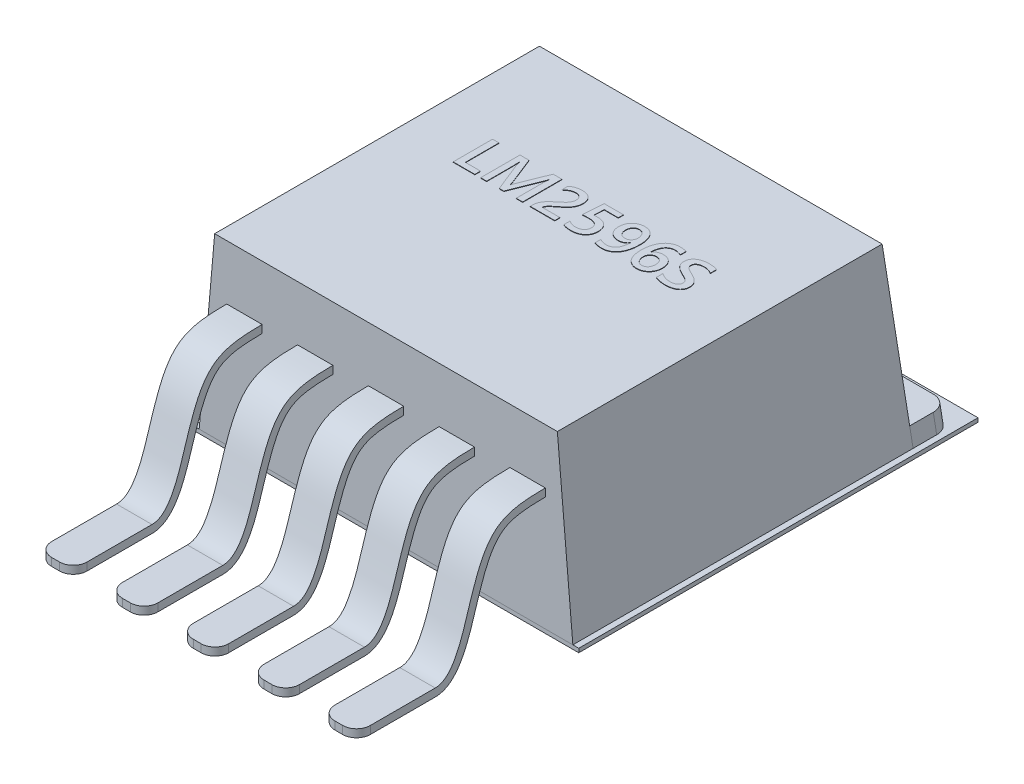
from build123d import *

# Parameters (mm, degrees)
SKETCH1_W           = 9.5
SKETCH1_H           = 8.65
BOSS_EXTRUDE1_DEPTH = 4.5
CHAMFER1_SIZE       = 4.5
CHAMFER1_SIZE_2     = 0.393698986
BOSS_EXTRUDE2_DEPTH = 0.5
SKETCH5_W           = 9.8
SKETCH5_H           = 10.15
BOSS_EXTRUDE3_DEPTH = 0.1
EXTRUDE_THIN1_START = -0.45
EXTRUDE_THIN1_DEPTH = 0.9
FILLET1_R           = 0.35
LPATTERN1_COUNT     = 3
LPATTERN1_PITCH     = 1.8
LPATTERN2_COUNT     = 3
LPATTERN2_PITCH     = 1.8
BOSS_EXTRUDE4_DEPTH = 0.01


# Read off the part's stored shape, not the designer's step: Extrude-Thin1
with BuildPart() as part:
    # Sketch1 → Boss-Extrude1 (new body)
    with BuildSketch(Plane(origin=(0, 0, 0), x_dir=(1, 0, 0), z_dir=(0, 1, 0))):
        Rectangle(SKETCH1_W, SKETCH1_H)
    extrude(amount=BOSS_EXTRUDE1_DEPTH)

    # Chamfer1
    # the kernel refuses this chamfer: 4.5, 0.393698986 mm, written as the material it takes off along each edge
    with BuildSketch(Plane(origin=(-4.75, 4.5, -16.023353359), x_dir=(-0.003352615794033216, -0.9999943799678764, 0), z_dir=(0, 0, 1)), Plane(origin=(4.75, 4.5, 16.023353359), x_dir=(0.003352615794033216, -0.9999943799678764, 0), z_dir=(0, 0, -1))) as chamfer1_piece_1:
        Polygon((CHAMFER1_SIZE * 0.999994379968, CHAMFER1_SIZE * 0.00335261579403), (-CHAMFER1_SIZE_2 * 0.0033526157929, CHAMFER1_SIZE_2 * 0.999994379629), (0, 0), align=None)
    extrude(amount=32.046706719, mode=Mode.SUBTRACT)
    with BuildSketch(Plane(origin=(16.448353359, 4.5, -4.325), x_dir=(0, -0.9999943799678764, -0.003352615794033216), z_dir=(-1, 0, 0))) as chamfer1_piece_2:
        Polygon((CHAMFER1_SIZE * 0.999994379968, CHAMFER1_SIZE * 0.00335261579403), (-CHAMFER1_SIZE_2 * 0.0033526157929, CHAMFER1_SIZE_2 * 0.999994379629), (0, 0), align=None)
    extrude(amount=32.896706719, mode=Mode.SUBTRACT)


with BuildPart() as body_2:
    # Sketch2 → Boss-Extrude2 (new, along a direction that is not the sketch's normal)
    with BuildSketch(Plane.XZ):
        with BuildLine():
            Line((0, -4.025), (4.75, -4.025))
            Line((4.75, -4.025), (4.75, -4.925))
            ThreePointArc((4.75, -4.925), (4.632842712, -5.207842712), (4.35, -5.325))
            Line((4.35, -5.325), (0, -5.325))
            Line((0, -5.325), (0, -4.025))
        make_face()
    extrude(amount=-BOSS_EXTRUDE2_DEPTH, dir=(0.08682659386424435, -0.9924325091389676, -0.08682659386424435))


with BuildPart() as body_3:
    # Mirror2: mirrored copy
    add(body_2.part.mirror(Plane(origin=(0, 0, 0), x_dir=(0, 0, 1), z_dir=(1, 0, 0))))


with BuildPart() as body_2_1:
    add(body_2.part)

    # Combine1: union body 3, part
    add(body_3.part)
    add(part.part)

    # Sketch7 → Boss-Extrude4 (add)
    # profile 1 of 7: a face of its own
    with BuildSketch(Plane(origin=(0, 4.5, 0), x_dir=(1, 0, 0), z_dir=(0, 1, 0))):
        Polygon((-2.344036286, 0.277881161), (-2.895023128, 0.277881161), (-2.895023128, 1.277881161), (-2.729727076, 1.277881161), (-2.729727076, 0.422618003), (-2.344036286, 0.422618003), align=None)
    # profile 2 of 7: a face of its own
    with BuildSketch(Plane(origin=(0, 4.5, 0), x_dir=(1, 0, 0), z_dir=(0, 1, 0))):
        with BuildLine():
            Line((-1.128986944, 0.277881161), (-1.292843852, 0.277881161))
            Line((-1.292843852, 0.277881161), (-1.292843852, 0.925085109))
            add(Edge.make_bspline(
                [(-1.292843852, 0.925085109), (-1.292712282, 0.939067113), (-1.292434853, 0.968549586), (-1.290442565, 1.014954023), (-1.287373248, 1.065813256), (-1.284483021, 1.101145404), (-1.282975431, 1.11957524)],
                knots=[0, 0, 0, 0, 0.861329844, 1.816201289, 2.860894294, 4, 4, 4, 4], degree=3))
            Line((-1.282975431, 1.11957524), (-1.28585372, 1.11957524))
            add(Edge.make_bspline(
                [(-1.28585372, 1.11957524), (-1.288257915, 1.109416125), (-1.292722069, 1.090552492), (-1.299782224, 1.064751168), (-1.305867666, 1.04334486), (-1.310654386, 1.030939245), (-1.312786286, 1.025414056)],
                knots=[0, 0, 0, 0, 1.277912959, 2.372852416, 3.275304104, 4, 4, 4, 4], degree=3))
            Line((-1.312786286, 1.025414056), (-1.609866878, 0.277881161))
            Line((-1.609866878, 0.277881161), (-1.723559312, 0.277881161))
            Line((-1.723559312, 0.277881161), (-2.021256681, 1.019863069))
            add(Edge.make_bspline(
                [(-2.021256681, 1.019863069), (-2.023444412, 1.026010207), (-2.028287148, 1.039617438), (-2.034703648, 1.062430352), (-2.04122631, 1.089557563), (-2.045487557, 1.109081001), (-2.047778062, 1.11957524)],
                knots=[0, 0, 0, 0, 0.758036603, 1.677980622, 2.751868064, 4, 4, 4, 4], degree=3))
            Line((-2.047778062, 1.11957524), (-2.05045076, 1.11957524))
            add(Edge.make_bspline(
                [(-2.05045076, 1.11957524), (-2.05003626, 1.114161719), (-2.049149856, 1.102584956), (-2.047802295, 1.084024406), (-2.047170057, 1.063105015), (-2.046244214, 1.0398108), (-2.045657407, 1.014108622), (-2.045332083, 0.986008833), (-2.044778562, 0.955583016), (-2.044858417, 0.934542625), (-2.044899773, 0.923645964)],
                knots=[0, 0, 0, 0, 0.664632124, 1.421309473, 2.277635459, 3.226175416, 4.275090468, 5.42449288, 6.666164143, 8, 8, 8, 8], degree=3))
            Line((-2.044899773, 0.923645964), (-2.044899773, 0.277881161))
            Line((-2.044899773, 0.277881161), (-2.197654707, 0.277881161))
            Line((-2.197654707, 0.277881161), (-2.197654707, 1.277881161))
            Line((-2.197654707, 1.277881161), (-1.965130036, 1.277881161))
            Line((-1.965130036, 1.277881161), (-1.703616878, 0.61176274))
            add(Edge.make_bspline(
                [(-1.703616878, 0.61176274), (-1.698952001, 0.599796873), (-1.690326738, 0.577672227), (-1.679399224, 0.546580477), (-1.670803185, 0.52052057), (-1.666614164, 0.504531013), (-1.66475997, 0.49745353)],
                knots=[0, 0, 0, 0, 1.275569132, 2.358501517, 3.273420907, 4, 4, 4, 4], degree=3))
            Line((-1.66475997, 0.49745353), (-1.661264905, 0.49745353))
            add(Edge.make_bspline(
                [(-1.661264905, 0.49745353), (-1.657156301, 0.509721492), (-1.649482678, 0.53263432), (-1.638745952, 0.564538258), (-1.628886303, 0.591323198), (-1.622439627, 0.607389138), (-1.619529707, 0.61464103)],
                knots=[0, 0, 0, 0, 1.247784235, 2.330482053, 3.246408086, 4, 4, 4, 4], degree=3))
            Line((-1.619529707, 0.61464103), (-1.353082339, 1.277881161))
            Line((-1.353082339, 1.277881161), (-1.128986944, 1.277881161))
            Line((-1.128986944, 1.277881161), (-1.128986944, 0.277881161))
        make_face()
    # profile 3 of 7: a face of its own
    with BuildSketch(Plane(origin=(0, 4.5, 0), x_dir=(1, 0, 0), z_dir=(0, 1, 0))):
        with BuildLine():
            Line((-0.31216951, 0.277881161), (-0.936552733, 0.277881161))
            Line((-0.936552733, 0.277881161), (-0.936552733, 0.350866359))
            add(Edge.make_bspline(
                [(-0.936552733, 0.350866359), (-0.936400622, 0.358275068), (-0.936099763, 0.372928609), (-0.933508474, 0.394712446), (-0.929450729, 0.416100024), (-0.921676049, 0.444013965), (-0.908826289, 0.477757976), (-0.888654894, 0.515979421), (-0.864518885, 0.551957002), (-0.83617416, 0.585363743), (-0.805309265, 0.61731833), (-0.772312534, 0.648109949), (-0.737928506, 0.677793427), (-0.702961413, 0.706829255), (-0.667634559, 0.734847307), (-0.64470475, 0.754115458), (-0.633304378, 0.763695306)],
                knots=[0, 0, 0, 0, 0.585705567, 1.158455539, 1.732409333, 2.305646261, 3.448039532, 4.580102136, 5.716450444, 6.86692659, 8.039791059, 9.228376671, 10.434622799, 11.631592839, 12.822462, 14, 14, 14, 14], degree=3))
            add(Edge.make_bspline(
                [(-0.633304378, 0.763695306), (-0.623119932, 0.772694033), (-0.603381577, 0.790134359), (-0.575280975, 0.816349707), (-0.550578699, 0.843003165), (-0.529743315, 0.870843554), (-0.512643246, 0.899788183), (-0.500084956, 0.930618659), (-0.49183955, 0.963583954), (-0.490900186, 0.9865063), (-0.490417865, 0.998275898)],
                knots=[0, 0, 0, 0, 1.146588771, 2.222189973, 3.241167182, 4.207872859, 5.15093082, 6.068913659, 7.008473637, 8, 8, 8, 8], degree=3))
            add(Edge.make_bspline(
                [(-0.490417865, 0.998275898), (-0.490580401, 1.004793742), (-0.49089623, 1.017458791), (-0.493193877, 1.035756266), (-0.496784962, 1.052822582), (-0.502255122, 1.068455631), (-0.508747186, 1.083025207), (-0.516890646, 1.09613083), (-0.525908096, 1.108309532), (-0.536490125, 1.118842545), (-0.547853717, 1.12852536), (-0.560440282, 1.136637518), (-0.57389932, 1.143738274), (-0.593392539, 1.151417795), (-0.619981089, 1.158272595), (-0.642094886, 1.15905716), (-0.653452405, 1.159460109)],
                knots=[0, 0, 0, 0, 1.054736146, 2.049494579, 2.980749419, 3.871759821, 4.725534204, 5.556891681, 6.364449321, 7.172387794, 7.967739829, 8.776895765, 9.590600965, 10.426901991, 12.164877501, 14, 14, 14, 14], degree=3))
            add(Edge.make_bspline(
                [(-0.653452405, 1.159460109), (-0.663686769, 1.159085737), (-0.684358792, 1.158329559), (-0.715426821, 1.152655852), (-0.746807659, 1.143853462), (-0.77822201, 1.131166847), (-0.809585248, 1.115182997), (-0.840219433, 1.095143787), (-0.870654322, 1.072048469), (-0.88950033, 1.05411396), (-0.89913497, 1.044945306)],
                knots=[0, 0, 0, 0, 0.883508961, 1.784567724, 2.719532515, 3.694429597, 4.705627225, 5.754725637, 6.852148938, 8, 8, 8, 8], degree=3))
            Line((-0.89913497, 1.044945306), (-0.89913497, 1.199961753))
            add(Edge.make_bspline(
                [(-0.89913497, 1.199961753), (-0.888966859, 1.207323503), (-0.869112788, 1.221697922), (-0.83778097, 1.240197293), (-0.805873904, 1.255834425), (-0.772949103, 1.268980989), (-0.738567213, 1.279168929), (-0.702338867, 1.286059144), (-0.664035688, 1.29022579), (-0.637769831, 1.290762807), (-0.624258326, 1.291039056)],
                knots=[0, 0, 0, 0, 1.020241161, 1.992104479, 2.954013209, 3.906987935, 4.871411042, 5.864760883, 6.901604691, 8, 8, 8, 8], degree=3))
            add(Edge.make_bspline(
                [(-0.624258326, 1.291039056), (-0.613282297, 1.290890693), (-0.591819147, 1.290600577), (-0.560497542, 1.286902707), (-0.530706622, 1.281455793), (-0.502465413, 1.27368419), (-0.476036696, 1.263565183), (-0.451232363, 1.251774057), (-0.42886865, 1.237203581), (-0.408298509, 1.220936926), (-0.389853183, 1.202473509), (-0.373533067, 1.181909508), (-0.359716618, 1.158960972), (-0.347957368, 1.134068276), (-0.338690328, 1.107044603), (-0.332257293, 1.078077931), (-0.327915943, 1.047269087), (-0.32756419, 1.026046639), (-0.327383326, 1.015134451)],
                knots=[0, 0, 0, 0, 1.145608329, 2.240187515, 3.288690502, 4.306155817, 5.293709029, 6.241108719, 7.168180035, 8.074608388, 8.975368673, 9.88740179, 10.8091543, 11.76636908, 12.757649311, 13.78540686, 14.861297311, 16, 16, 16, 16], degree=3))
            add(Edge.make_bspline(
                [(-0.327383326, 1.015134451), (-0.327610538, 1.005261028), (-0.328054759, 0.985957629), (-0.330651313, 0.957691975), (-0.335375223, 0.930954516), (-0.341991612, 0.905673787), (-0.350417452, 0.881655955), (-0.359879419, 0.858344211), (-0.371575515, 0.83614801), (-0.38457383, 0.814673894), (-0.398993597, 0.793867732), (-0.414934842, 0.773689289), (-0.432147064, 0.753916315), (-0.457752657, 0.728057773), (-0.492859544, 0.69566581), (-0.522401579, 0.670460354), (-0.537704049, 0.657404188)],
                knots=[0, 0, 0, 0, 0.960573243, 1.878004235, 2.758125645, 3.598967152, 4.416981938, 5.232875045, 6.043905586, 6.854525027, 7.67376136, 8.504633165, 9.35504015, 10.222470933, 12.043278799, 14, 14, 14, 14], degree=3))
            add(Edge.make_bspline(
                [(-0.537704049, 0.657404188), (-0.551033975, 0.646534395), (-0.577519472, 0.624936984), (-0.617200241, 0.593791235), (-0.654879263, 0.563346506), (-0.688953678, 0.533569088), (-0.718140677, 0.504038486), (-0.738026639, 0.478747787), (-0.750012666, 0.45832139), (-0.756343958, 0.443288093), (-0.760238204, 0.428161162), (-0.760732941, 0.417979473), (-0.760977076, 0.412955174)],
                knots=[0, 0, 0, 0, 1.51932221, 3.018771876, 4.45587393, 5.798161447, 7.013966499, 8.119417259, 8.62925562, 9.101440561, 9.556593155, 10, 10, 10, 10], degree=3))
            Line((-0.760977076, 0.412955174), (-0.760977076, 0.409460109))
            Line((-0.760977076, 0.409460109), (-0.31216951, 0.409460109))
            Line((-0.31216951, 0.409460109), (-0.31216951, 0.277881161))
        make_face()
    # profile 4 of 7: a face of its own
    with BuildSketch(Plane(origin=(0, 4.5, 0), x_dir=(1, 0, 0), z_dir=(0, 1, 0))):
        with BuildLine():
            Line((-0.107605365, 0.305841688), (-0.107605365, 0.461063727))
            add(Edge.make_bspline(
                [(-0.107605365, 0.461063727), (-0.0995201, 0.455874852), (-0.08358798, 0.445650106), (-0.05886136, 0.432575545), (-0.034166377, 0.421371237), (-0.009332775, 0.412332579), (0.015478081, 0.404980083), (0.040555209, 0.400173462), (0.065621587, 0.396884824), (0.08241986, 0.396495985), (0.090791017, 0.396302214)],
                knots=[0, 0, 0, 0, 1.088538388, 2.144978999, 3.167165092, 4.160004579, 5.138457433, 6.096689498, 7.051515066, 8, 8, 8, 8], degree=3))
            add(Edge.make_bspline(
                [(0.090791017, 0.396302214), (0.099022792, 0.396443675), (0.115113596, 0.396720192), (0.138653652, 0.39936463), (0.161072945, 0.403015038), (0.18212167, 0.408945517), (0.201995733, 0.416057958), (0.220591166, 0.424947456), (0.237956306, 0.435471034), (0.25399972, 0.447609134), (0.268449998, 0.461050646), (0.281262038, 0.475523599), (0.291751962, 0.491399881), (0.300618934, 0.508159874), (0.307491163, 0.52602863), (0.312168196, 0.544956144), (0.315105776, 0.564933197), (0.31550504, 0.578652012), (0.31570878, 0.585652543)],
                knots=[0, 0, 0, 0, 1.19386348, 2.333666919, 3.43383355, 4.485573836, 5.501596343, 6.493391529, 7.470523889, 8.442990654, 9.406879365, 10.330111905, 11.240185552, 12.160844317, 13.076765713, 14.010063497, 14.984561526, 16, 16, 16, 16], degree=3))
            add(Edge.make_bspline(
                [(0.31570878, 0.585652543), (0.315496702, 0.592513945), (0.315081229, 0.605955859), (0.31227001, 0.625507987), (0.307203591, 0.643806096), (0.300494225, 0.661111499), (0.291373679, 0.677031342), (0.280530941, 0.691907117), (0.267717668, 0.705549905), (0.252821575, 0.717792085), (0.236304318, 0.729005906), (0.217968713, 0.738672148), (0.197832228, 0.746566902), (0.176185093, 0.753505735), (0.152679847, 0.758465031), (0.127560087, 0.762230103), (0.100757904, 0.764164401), (0.082364243, 0.764533461), (0.072904503, 0.764723267)],
                knots=[0, 0, 0, 0, 0.965774522, 1.892012458, 2.771835267, 3.633385432, 4.497200425, 5.346076443, 6.219531331, 7.123554825, 8.054551851, 9.025370871, 10.033795942, 11.095436101, 12.221175977, 13.410690107, 14.66833495, 16, 16, 16, 16], degree=3))
            add(Edge.make_bspline(
                [(0.072904503, 0.764723267), (0.06913513, 0.76466321), (0.060704196, 0.764528881), (0.046792166, 0.764097219), (0.030277019, 0.76345891), (0.011150258, 0.762691872), (-0.010566869, 0.761378719), (-0.034827017, 0.759949134), (-0.061630238, 0.758348655), (-0.080331549, 0.757000402), (-0.090130036, 0.75629399)],
                knots=[0, 0, 0, 0, 0.554140998, 1.239443782, 2.045900301, 2.983613663, 4.053127261, 5.243904845, 6.555953537, 8, 8, 8, 8], degree=3))
            Line((-0.090130036, 0.75629399), (-0.054768194, 1.277881161))
            Line((-0.054768194, 1.277881161), (0.434952201, 1.277881161))
            Line((0.434952201, 1.277881161), (0.434952201, 1.146302214))
            Line((0.434952201, 1.146302214), (0.079072267, 1.146302214))
            Line((0.079072267, 1.146302214), (0.062419306, 0.893629517))
            add(Edge.make_bspline(
                [(0.062419306, 0.893629517), (0.077629513, 0.894435053), (0.106530268, 0.895965645), (0.13547011, 0.896194027), (0.149179174, 0.896302214)],
                knots=[0, 0, 0, 0, 1.052581973, 2, 2, 2, 2], degree=3))
            add(Edge.make_bspline(
                [(0.149179174, 0.896302214), (0.162005426, 0.896098591), (0.186967338, 0.89570231), (0.223255827, 0.89167745), (0.257300379, 0.885380838), (0.289159785, 0.876622425), (0.318687951, 0.865051319), (0.346089598, 0.851011547), (0.371243225, 0.834378901), (0.393955507, 0.815074887), (0.41427665, 0.793820257), (0.431943943, 0.770474754), (0.447042246, 0.745377021), (0.459171268, 0.718206858), (0.468636038, 0.689263282), (0.47544009, 0.658492346), (0.479291933, 0.625840894), (0.479880803, 0.603480501), (0.480182464, 0.592025898)],
                knots=[0, 0, 0, 0, 1.206714575, 2.348457229, 3.43127716, 4.462523489, 5.45303028, 6.410718438, 7.3552197, 8.284267592, 9.210355584, 10.117198089, 11.03416762, 11.960816924, 12.911267271, 13.895559965, 14.921954295, 16, 16, 16, 16], degree=3))
            add(Edge.make_bspline(
                [(0.480182464, 0.592025898), (0.479840556, 0.579952206), (0.479171758, 0.556335163), (0.474702268, 0.521789239), (0.466773164, 0.48919599), (0.456194928, 0.458271437), (0.442010216, 0.429314765), (0.424952396, 0.402136259), (0.404821212, 0.376756335), (0.381539106, 0.353645794), (0.355725347, 0.332633587), (0.32730724, 0.314517074), (0.296722901, 0.298929225), (0.263696687, 0.28655391), (0.228517127, 0.276551955), (0.190932084, 0.269673049), (0.151053254, 0.265559677), (0.123695796, 0.265006272), (0.10970549, 0.264723267)],
                knots=[0, 0, 0, 0, 1.03819011, 2.030777286, 2.988376512, 3.918325881, 4.835472902, 5.754303197, 6.672755497, 7.614448779, 8.569724437, 9.529225514, 10.506938197, 11.515971313, 12.556900451, 13.647929811, 14.797177, 16, 16, 16, 16], degree=3))
            add(Edge.make_bspline(
                [(0.10970549, 0.264723267), (0.097913745, 0.264804728), (0.075133204, 0.264962103), (0.042160157, 0.26720654), (0.011454595, 0.270061874), (-0.016878346, 0.274633973), (-0.042973046, 0.280234782), (-0.066590432, 0.28757081), (-0.088247441, 0.2955088), (-0.101298497, 0.302475203), (-0.107605365, 0.305841688)],
                knots=[0, 0, 0, 0, 1.266359308, 2.446487028, 3.548884881, 4.577591023, 5.527758035, 6.412662473, 7.232925813, 8, 8, 8, 8], degree=3))
        make_face()
    # profile 5 of 7: a face of its own
    with BuildSketch(Plane(origin=(0, 4.5, 0), x_dir=(1, 0, 0), z_dir=(0, 1, 0))):
        with BuildLine():
            add(Edge.make_bspline(
                [(1.300906148, 0.832157477), (1.300870347, 0.819956459), (1.300800116, 0.79602216), (1.298973814, 0.760792204), (1.296623283, 0.726843499), (1.293137846, 0.694199147), (1.288621692, 0.662856873), (1.283085051, 0.632812455), (1.276526661, 0.603996163), (1.266560848, 0.567912591), (1.251934094, 0.525755525), (1.231655183, 0.478797034), (1.207654311, 0.436839033), (1.180893906, 0.39957587), (1.151316329, 0.366981039), (1.119087859, 0.339114979), (1.084512662, 0.315580483), (1.047522453, 0.296914162), (1.00872217, 0.282517327), (0.968347035, 0.272214395), (0.926518097, 0.265881362), (0.898104738, 0.265111795), (0.883759767, 0.264723267)],
                knots=[0, 0, 0, 0, 0.921378768, 1.807435742, 2.663724516, 3.491392488, 4.286336139, 5.054839616, 5.798162042, 6.517694744, 7.881213555, 9.165112121, 10.375279555, 11.524528848, 12.623710389, 13.691527061, 14.735198482, 15.774548477, 16.812892711, 17.854855711, 18.916987114, 20, 20, 20, 20], degree=3))
            add(Edge.make_bspline(
                [(0.883759767, 0.264723267), (0.874296249, 0.264867977), (0.855194807, 0.265160066), (0.826717733, 0.267964837), (0.798839466, 0.272117837), (0.772270643, 0.276924879), (0.747648812, 0.282664715), (0.72550264, 0.288949997), (0.706271187, 0.295372669), (0.694730091, 0.300164718), (0.689475227, 0.302346622)],
                knots=[0, 0, 0, 0, 1.140787844, 2.302599656, 3.446644809, 4.539001454, 5.557209523, 6.493605997, 7.314112248, 8, 8, 8, 8], degree=3))
            Line((0.689475227, 0.302346622), (0.689475227, 0.448111424))
            add(Edge.make_bspline(
                [(0.689475227, 0.448111424), (0.6948562, 0.44503574), (0.706571744, 0.438339311), (0.726065063, 0.428998434), (0.748413771, 0.420479328), (0.772598718, 0.412275613), (0.798436761, 0.405952974), (0.824994408, 0.40048996), (0.85174244, 0.397153995), (0.869497026, 0.396582589), (0.87820878, 0.396302214)],
                knots=[0, 0, 0, 0, 0.752042271, 1.637358727, 2.61959686, 3.65316523, 4.734321835, 5.845045844, 6.94261509, 8, 8, 8, 8], degree=3))
            add(Edge.make_bspline(
                [(0.87820878, 0.396302214), (0.887821377, 0.396563003), (0.906735283, 0.397076136), (0.934351159, 0.401588649), (0.960718902, 0.408426597), (0.985544674, 0.418638696), (1.008827577, 0.431665107), (1.030623642, 0.447256493), (1.050194732, 0.466090372), (1.068255816, 0.487351834), (1.08422894, 0.511584733), (1.098468938, 0.538407346), (1.110553907, 0.567973843), (1.120635854, 0.600233988), (1.12851585, 0.63524284), (1.134588241, 0.672847307), (1.137698837, 0.713135662), (1.138219855, 0.740801568), (1.138488385, 0.755060438)],
                knots=[0, 0, 0, 0, 0.922572499, 1.815268897, 2.680565443, 3.533661322, 4.385156239, 5.238252118, 6.099534509, 6.986901619, 7.912380604, 8.881036506, 9.899162739, 10.97534695, 12.12328122, 13.342740154, 14.63046156, 16, 16, 16, 16], degree=3))
            Line((1.138488385, 0.755060438), (1.135610095, 0.755060438))
            add(Edge.make_bspline(
                [(1.135610095, 0.755060438), (1.131022896, 0.747777549), (1.121539991, 0.732721973), (1.102863311, 0.712687819), (1.080960726, 0.694241554), (1.055821437, 0.678306864), (1.027781178, 0.664814792), (0.997000914, 0.65433799), (0.963408777, 0.647532052), (0.940125421, 0.646719514), (0.928167661, 0.646302214)],
                knots=[0, 0, 0, 0, 0.842698899, 1.742072349, 2.672462632, 3.645837033, 4.653022821, 5.718016251, 6.828029235, 8, 8, 8, 8], degree=3))
            add(Edge.make_bspline(
                [(0.928167661, 0.646302214), (0.917946169, 0.646611316), (0.897771546, 0.647221405), (0.868054286, 0.651080455), (0.839451479, 0.658010064), (0.811914293, 0.667352979), (0.785945669, 0.679493721), (0.761532837, 0.693827372), (0.739000737, 0.710429355), (0.718198099, 0.729313508), (0.69949455, 0.750469144), (0.683043746, 0.773964637), (0.66827954, 0.799306107), (0.656050813, 0.826901119), (0.646077676, 0.856317473), (0.639232977, 0.887557049), (0.634729266, 0.920362679), (0.634223477, 0.942819055), (0.633965359, 0.954279188)],
                knots=[0, 0, 0, 0, 1.027152021, 2.027336404, 3.004402546, 3.979987383, 4.944279273, 5.879615817, 6.820285557, 7.751328455, 8.69775235, 9.651139833, 10.629103379, 11.640109547, 12.678806962, 13.744632038, 14.849021069, 16, 16, 16, 16], degree=3))
            add(Edge.make_bspline(
                [(0.633965359, 0.954279188), (0.634284936, 0.966835452), (0.634910724, 0.991422818), (0.639706141, 1.027375666), (0.647647611, 1.06151209), (0.659091392, 1.093581844), (0.672984295, 1.123756375), (0.689741528, 1.151448066), (0.708519142, 1.177111418), (0.729970429, 1.200157085), (0.753779135, 1.220652418), (0.779217152, 1.239213636), (0.807130189, 1.254552781), (0.836661606, 1.267736919), (0.86788956, 1.278271942), (0.900558391, 1.285562513), (0.934401823, 1.290302734), (0.957414082, 1.290791346), (0.96908049, 1.291039056)],
                knots=[0, 0, 0, 0, 1.130643865, 2.213998782, 3.260521987, 4.281522911, 5.275657393, 6.247427141, 7.191837754, 8.135239273, 9.075910832, 10.018039354, 10.965892948, 11.938564025, 12.928185147, 13.928432736, 14.949788099, 16, 16, 16, 16], degree=3))
            add(Edge.make_bspline(
                [(0.96908049, 1.291039056), (0.98020014, 1.290718204), (1.002198009, 1.290083466), (1.034694166, 1.28515538), (1.066281525, 1.277422937), (1.096861495, 1.26627481), (1.12608112, 1.25176087), (1.153584269, 1.233401597), (1.179131275, 1.211241337), (1.202836041, 1.185370824), (1.224627445, 1.155789077), (1.243691927, 1.121944487), (1.260444105, 1.084171384), (1.27515915, 1.042449232), (1.286864421, 0.996305171), (1.295145659, 0.945621404), (1.300040642, 0.890368339), (1.3006105, 0.852041745), (1.300906148, 0.832157477)],
                knots=[0, 0, 0, 0, 0.835645901, 1.653148205, 2.465357174, 3.277026735, 4.094967252, 4.912307195, 5.756124128, 6.631211223, 7.545228366, 8.512081958, 9.545227742, 10.648351808, 11.834191957, 13.119073497, 14.505342951, 16, 16, 16, 16], degree=3))
        make_face()
        with BuildLine():
            add(Edge.make_bspline(
                [(1.132937398, 0.939476556), (1.132795889, 0.947571369), (1.132519374, 0.963388934), (1.129878011, 0.986519241), (1.126206619, 1.008593017), (1.120272368, 1.02934087), (1.113355891, 1.04888332), (1.105226889, 1.06708529), (1.095401304, 1.083648627), (1.084513458, 1.098828772), (1.072697949, 1.112772901), (1.059310111, 1.124667975), (1.045206524, 1.135306706), (1.029845804, 1.143862741), (1.013811999, 1.151005401), (0.996799795, 1.155923772), (0.97904929, 1.158830711), (0.966966852, 1.159248722), (0.960856806, 1.159460109)],
                knots=[0, 0, 0, 0, 1.244256692, 2.431323559, 3.576582121, 4.681114951, 5.74445903, 6.763155997, 7.740967073, 8.700201715, 9.63409316, 10.544316594, 11.448541582, 12.345243052, 13.241944521, 14.142353938, 15.060594976, 16, 16, 16, 16], degree=3))
            add(Edge.make_bspline(
                [(0.960856806, 1.159460109), (0.955366116, 1.159300707), (0.944465778, 1.158984256), (0.92824068, 1.156471777), (0.912517382, 1.152087043), (0.897171384, 1.146373847), (0.882601263, 1.13891993), (0.868779948, 1.130100205), (0.855955335, 1.119756094), (0.844264774, 1.107963767), (0.833449797, 1.094988729), (0.824023045, 1.080527565), (0.815824357, 1.064779827), (0.80859723, 1.047990504), (0.802807582, 1.030041951), (0.798737606, 1.011034129), (0.796210893, 0.991011286), (0.795916658, 0.977313159), (0.795766345, 0.970315372)],
                knots=[0, 0, 0, 0, 0.940085965, 1.866296451, 2.803006345, 3.731593256, 4.665873671, 5.600227799, 6.535024086, 7.481098385, 8.439827583, 9.422887936, 10.430853849, 11.477239173, 12.549885702, 13.654855137, 14.801965704, 16, 16, 16, 16], degree=3))
            add(Edge.make_bspline(
                [(0.795766345, 0.970315372), (0.795911079, 0.962769076), (0.796193469, 0.948045506), (0.798763586, 0.926677558), (0.802551449, 0.906625374), (0.808116753, 0.887942982), (0.815346927, 0.870822893), (0.823576408, 0.854891271), (0.833294706, 0.840588997), (0.843927629, 0.82746826), (0.856097198, 0.816033002), (0.869334866, 0.806036019), (0.883835063, 0.797464173), (0.899371512, 0.790277697), (0.916011219, 0.784776365), (0.933510686, 0.780892112), (0.951735396, 0.778330736), (0.96420608, 0.778032267), (0.970519635, 0.777881161)],
                knots=[0, 0, 0, 0, 1.232343618, 2.404424184, 3.511046617, 4.563027738, 5.581838633, 6.543368197, 7.487334399, 8.401895552, 9.296783444, 10.208118137, 11.106710138, 12.043478526, 12.999386209, 13.963584433, 14.9690203, 16, 16, 16, 16], degree=3))
            add(Edge.make_bspline(
                [(0.970519635, 0.777881161), (0.976217902, 0.778030295), (0.987463481, 0.778324612), (1.003904664, 0.780917557), (1.019718044, 0.784756306), (1.039619084, 0.792231825), (1.062678206, 0.804623886), (1.082827274, 0.821007571), (1.096555621, 0.836153172), (1.105784729, 0.848467696), (1.113968409, 0.861763531), (1.120576398, 0.876111651), (1.126268706, 0.891096477), (1.130122522, 0.906765963), (1.13243272, 0.922960079), (1.132767548, 0.933917901), (1.132937398, 0.939476556)],
                knots=[0, 0, 0, 0, 0.938279422, 1.851702532, 2.736264803, 3.615115264, 5.348051908, 7.02516731, 7.864465896, 8.711325883, 9.557583444, 10.431414562, 11.310265023, 12.194827294, 13.084276687, 14, 14, 14, 14], degree=3))
        make_face(mode=Mode.SUBTRACT)
    # profile 6 of 7: a face of its own
    with BuildSketch(Plane(origin=(0, 4.5, 0), x_dir=(1, 0, 0), z_dir=(0, 1, 0))):
        with BuildLine():
            add(Edge.make_bspline(
                [(2.102715359, 0.601688727), (2.102493716, 0.589471325), (2.102058629, 0.565488404), (2.097006161, 0.530365449), (2.089704381, 0.496721339), (2.078536217, 0.465063426), (2.065336557, 0.435163873), (2.049296684, 0.407412361), (2.031057921, 0.381613053), (2.010241949, 0.358170741), (1.987244185, 0.337104534), (1.962363609, 0.318256073), (1.935193962, 0.302211504), (1.906246073, 0.288623238), (1.87559087, 0.277912548), (1.843473292, 0.270392438), (1.81017616, 0.265418156), (1.787492235, 0.264956535), (1.776029503, 0.264723267)],
                knots=[0, 0, 0, 0, 1.114607756, 2.187989606, 3.233826965, 4.25287391, 5.247127542, 6.214133429, 7.17425243, 8.127229402, 9.070461217, 10.017772585, 10.971735013, 11.945840358, 12.933278202, 13.930362903, 14.954162641, 16, 16, 16, 16], degree=3))
            add(Edge.make_bspline(
                [(1.776029503, 0.264723267), (1.76374326, 0.265083043), (1.739599962, 0.265790027), (1.704147076, 0.271250462), (1.670224026, 0.280326046), (1.637846431, 0.292993477), (1.607547565, 0.30965016), (1.579061701, 0.329397799), (1.553100889, 0.353153404), (1.529133284, 0.380144584), (1.507640739, 0.410850138), (1.488840323, 0.445119199), (1.472319317, 0.482723187), (1.458584636, 0.523801047), (1.447726547, 0.568356803), (1.439968406, 0.616400073), (1.435533708, 0.667874183), (1.434878316, 0.703311163), (1.434541017, 0.721548924)],
                knots=[0, 0, 0, 0, 0.917531533, 1.80301148, 2.67228629, 3.536435622, 4.393214027, 5.249625281, 6.119502874, 7.015282184, 7.941314958, 8.912924036, 9.930695231, 11.005648931, 12.144242474, 13.352823914, 14.637621846, 16, 16, 16, 16], degree=3))
            add(Edge.make_bspline(
                [(1.434541017, 0.721548924), (1.43490834, 0.743905536), (1.435621941, 0.787337885), (1.441926001, 0.850548715), (1.451986563, 0.909844605), (1.466446864, 0.9651696), (1.484425015, 1.016336299), (1.505745131, 1.063245941), (1.529579952, 1.106156005), (1.557234682, 1.144275771), (1.587146512, 1.178506792), (1.620157008, 1.207932132), (1.655194845, 1.23363531), (1.693056362, 1.254290973), (1.732716498, 1.270856148), (1.774186044, 1.28259445), (1.817235389, 1.289830265), (1.84651912, 1.290632669), (1.861350227, 1.291039056)],
                knots=[0, 0, 0, 0, 1.345358543, 2.61363761, 3.819386855, 4.961954262, 6.051317593, 7.079558431, 8.060371929, 9.000221742, 9.909026459, 10.791124411, 11.656661383, 12.518859828, 13.380653622, 14.238489583, 15.107861266, 16, 16, 16, 16], degree=3))
            add(Edge.make_bspline(
                [(1.861350227, 1.291039056), (1.870466551, 1.290975945), (1.888368595, 1.290852012), (1.91457468, 1.28941662), (1.939531076, 1.286914758), (1.963063513, 1.283678037), (1.984914749, 1.279689904), (2.004601825, 1.274758805), (2.022043488, 1.269338744), (2.032571702, 1.264807024), (2.037542661, 1.262667345)],
                knots=[0, 0, 0, 0, 1.217707414, 2.391254823, 3.504402734, 4.56732931, 5.563842523, 6.469737629, 7.277477499, 8, 8, 8, 8], degree=3))
            Line((2.037542661, 1.262667345), (2.037542661, 1.11854728))
            add(Edge.make_bspline(
                [(2.037542661, 1.11854728), (2.02542654, 1.124021301), (2.00078518, 1.135154182), (1.968352281, 1.146132035), (1.940732956, 1.153010131), (1.918365738, 1.157016244), (1.894413866, 1.158885699), (1.878005419, 1.159265135), (1.869573911, 1.159460109)],
                knots=[0, 0, 0, 0, 1.371224309, 2.78874999, 3.524403868, 4.306690131, 5.129890008, 6, 6, 6, 6], degree=3))
            add(Edge.make_bspline(
                [(1.869573911, 1.159460109), (1.860032346, 1.159189987), (1.841259676, 1.158658533), (1.813643714, 1.154253157), (1.787191066, 1.146776403), (1.761917655, 1.136558194), (1.738104076, 1.123440234), (1.715723099, 1.107852422), (1.695330519, 1.089095168), (1.676522137, 1.067851957), (1.659636171, 1.043821993), (1.644603352, 1.017152057), (1.631509336, 0.987803309), (1.620070928, 0.955916542), (1.611463841, 0.921310508), (1.60472822, 0.884251689), (1.600986638, 0.844635944), (1.600226764, 0.817361856), (1.599837069, 0.803374582)],
                knots=[0, 0, 0, 0, 0.913441438, 1.797161676, 2.669845707, 3.54127015, 4.401876131, 5.268616729, 6.146738096, 7.048790728, 7.98113537, 8.953951868, 9.976211702, 11.055654253, 12.193816762, 13.387255587, 14.660077271, 16, 16, 16, 16], degree=3))
            Line((1.599837069, 0.803374582), (1.603948911, 0.803374582))
            add(Edge.make_bspline(
                [(1.603948911, 0.803374582), (1.609484778, 0.811298662), (1.62058117, 0.827182116), (1.64124242, 0.847776904), (1.664259827, 0.866254023), (1.690307294, 0.881500443), (1.718728882, 0.894295904), (1.749918714, 0.902970831), (1.783375308, 0.908434892), (1.806503379, 0.909112238), (1.818381477, 0.909460109)],
                knots=[0, 0, 0, 0, 0.927283216, 1.858696682, 2.791575824, 3.757260035, 4.750924201, 5.778576897, 6.859123069, 8, 8, 8, 8], degree=3))
            add(Edge.make_bspline(
                [(1.818381477, 0.909460109), (1.829019742, 0.909275012), (1.849832531, 0.908912888), (1.880157484, 0.904564286), (1.908922772, 0.898141104), (1.935960473, 0.888778285), (1.961337721, 0.877160585), (1.984703205, 0.86281374), (2.006211343, 0.846285232), (2.025860967, 0.827523077), (2.043326158, 0.80640998), (2.058979662, 0.783243796), (2.071987092, 0.757593865), (2.083115897, 0.730025962), (2.091966231, 0.700512596), (2.098334262, 0.66914588), (2.102029477, 0.635974777), (2.102483485, 0.613279705), (2.102715359, 0.601688727)],
                knots=[0, 0, 0, 0, 1.07790046, 2.108813365, 3.099989115, 4.062518597, 5.004562069, 5.924614927, 6.836390489, 7.750546187, 8.673193369, 9.609864928, 10.579541943, 11.583472917, 12.621132202, 13.699122256, 14.824880431, 16, 16, 16, 16], degree=3))
        make_face()
        with BuildLine():
            add(Edge.make_bspline(
                [(1.940503188, 0.586680503), (1.940382901, 0.593673554), (1.940147783, 0.607342536), (1.938367056, 0.627361762), (1.934923841, 0.646339217), (1.930790393, 0.664495233), (1.924986177, 0.681535332), (1.918056281, 0.697405999), (1.909781644, 0.711997201), (1.900042905, 0.725173222), (1.889153377, 0.737166886), (1.876909777, 0.747791858), (1.863251879, 0.756809738), (1.848396912, 0.764484157), (1.832174211, 0.770486829), (1.814647604, 0.774712525), (1.795787221, 0.777512692), (1.78275618, 0.777755713), (1.776029503, 0.777881161)],
                knots=[0, 0, 0, 0, 1.172319891, 2.291477639, 3.364271901, 4.403635593, 5.409966471, 6.376970151, 7.303191693, 8.21541412, 9.118037, 10.013982118, 10.925263624, 11.855253635, 12.811276079, 13.81714782, 14.873202861, 16, 16, 16, 16], degree=3))
            add(Edge.make_bspline(
                [(1.776029503, 0.777881161), (1.769300615, 0.777769494), (1.756119574, 0.777550752), (1.73706527, 0.774496782), (1.719120793, 0.770133087), (1.702693341, 0.763473528), (1.687650901, 0.755268009), (1.673477472, 0.746411852), (1.660999021, 0.735671141), (1.649382898, 0.724293261), (1.639404778, 0.711697899), (1.630532053, 0.698349803), (1.623291421, 0.683991767), (1.614999077, 0.664012258), (1.608220442, 0.637680946), (1.607153024, 0.616122348), (1.606621609, 0.605389385)],
                knots=[0, 0, 0, 0, 1.043110063, 2.043320813, 2.987394098, 3.903744512, 4.783957728, 5.645337203, 6.490946687, 7.333205616, 8.165331942, 8.979457534, 9.816597939, 10.655964696, 12.335169772, 14, 14, 14, 14], degree=3))
            add(Edge.make_bspline(
                [(1.606621609, 0.605389385), (1.607108832, 0.593497433), (1.60810685, 0.569138243), (1.614679693, 0.539019553), (1.622142101, 0.515219844), (1.629203629, 0.497943887), (1.637651913, 0.481540304), (1.64729283, 0.465853311), (1.658317914, 0.451132869), (1.671230654, 0.438050742), (1.685216582, 0.425979356), (1.700681821, 0.415490734), (1.717565873, 0.406574982), (1.736334963, 0.400827681), (1.756405799, 0.396933999), (1.770321529, 0.396516593), (1.777468648, 0.396302214)],
                knots=[0, 0, 0, 0, 1.657879545, 3.395960648, 4.278813231, 5.13630038, 5.995703942, 6.849987517, 7.702771972, 8.55464496, 9.409088998, 10.276168559, 11.156948228, 12.060925775, 13.004091386, 14, 14, 14, 14], degree=3))
            add(Edge.make_bspline(
                [(1.777468648, 0.396302214), (1.783856889, 0.396407542), (1.796360282, 0.396613695), (1.814422169, 0.399756764), (1.831558672, 0.403868717), (1.847405274, 0.410325585), (1.862003276, 0.418494178), (1.875688922, 0.427544874), (1.887714797, 0.43854398), (1.898633419, 0.450639295), (1.908265583, 0.464063508), (1.916785394, 0.478560032), (1.923977785, 0.494275282), (1.929906747, 0.511147882), (1.93456197, 0.528971053), (1.938117528, 0.547570573), (1.940198417, 0.566895623), (1.940400712, 0.580028054), (1.940503188, 0.586680503)],
                knots=[0, 0, 0, 0, 1.084696199, 2.123023052, 3.109375058, 4.076613271, 5.020547962, 5.951373323, 6.859082279, 7.783246515, 8.717929556, 9.663229822, 10.638228156, 11.651738769, 12.700345693, 13.767627071, 14.869154751, 16, 16, 16, 16], degree=3))
        make_face(mode=Mode.SUBTRACT)
    # profile 7 of 7: a face of its own
    with BuildSketch(Plane(origin=(0, 4.5, 0), x_dir=(1, 0, 0), z_dir=(0, 1, 0))):
        with BuildLine():
            Line((2.230388056, 0.320233135), (2.230388056, 0.488407477))
            add(Edge.make_bspline(
                [(2.230388056, 0.488407477), (2.23858603, 0.481408002), (2.255528346, 0.466942558), (2.28488361, 0.44887476), (2.317350621, 0.433667876), (2.351561387, 0.420483507), (2.386734999, 0.410150158), (2.421745863, 0.402350961), (2.455443586, 0.397441898), (2.47735866, 0.396669734), (2.487789372, 0.396302214)],
                knots=[0, 0, 0, 0, 0.927532116, 1.91688131, 2.957261661, 4.013071167, 5.072176481, 6.112070983, 7.101420177, 8, 8, 8, 8], degree=3))
            add(Edge.make_bspline(
                [(2.487789372, 0.396302214), (2.496153535, 0.396426527), (2.512418615, 0.396668269), (2.535946942, 0.398355814), (2.557970402, 0.400838065), (2.578167503, 0.405090367), (2.596877363, 0.409854385), (2.613766506, 0.416091839), (2.629141514, 0.423214674), (2.642777066, 0.43168509), (2.654800468, 0.441248506), (2.665416113, 0.451651605), (2.674079069, 0.463407892), (2.681402782, 0.475974116), (2.686840746, 0.489665272), (2.691153142, 0.504213701), (2.693261383, 0.519870156), (2.693613097, 0.530617746), (2.693792661, 0.536104845)],
                knots=[0, 0, 0, 0, 1.422538964, 2.766291283, 4.01115188, 5.188471685, 6.274229209, 7.292034068, 8.246241698, 9.151940231, 10.014845965, 10.855579266, 11.671543487, 12.491328798, 13.322553718, 14.171169317, 15.066304526, 16, 16, 16, 16], degree=3))
            add(Edge.make_bspline(
                [(2.693792661, 0.536104845), (2.69362132, 0.541809933), (2.693285903, 0.552978159), (2.689910344, 0.569047283), (2.684513456, 0.583943661), (2.676946815, 0.597629608), (2.667579883, 0.61050628), (2.656310185, 0.622594127), (2.643652193, 0.634380713), (2.623645382, 0.649172638), (2.595170987, 0.667114692), (2.556493789, 0.686768249), (2.513800597, 0.706551605), (2.484293868, 0.720245214), (2.46908049, 0.727305503)],
                knots=[0, 0, 0, 0, 0.656693753, 1.285537614, 1.882686042, 2.476430096, 3.081464753, 3.713129111, 4.378269281, 5.071690648, 6.576914212, 8.251291727, 10.067203054, 12, 12, 12, 12], degree=3))
            add(Edge.make_bspline(
                [(2.46908049, 0.727305503), (2.452705146, 0.736236793), (2.420727488, 0.753677751), (2.382207896, 0.776806409), (2.35336866, 0.795738142), (2.333843286, 0.810940698), (2.315451969, 0.826497433), (2.298484721, 0.842933506), (2.283297723, 0.860459944), (2.269543176, 0.87885744), (2.257640516, 0.898404504), (2.247411908, 0.919114576), (2.239261607, 0.941406477), (2.233592942, 0.965415823), (2.230314179, 0.991264185), (2.229820961, 1.009025587), (2.229565688, 1.018218332)],
                knots=[0, 0, 0, 0, 1.957585687, 3.822759565, 4.714508102, 5.576279237, 6.418097221, 7.242118797, 8.052752078, 8.849739743, 9.650354514, 10.45135693, 11.27052961, 12.135865573, 13.035182453, 14, 14, 14, 14], degree=3))
            add(Edge.make_bspline(
                [(2.229565688, 1.018218332), (2.229980762, 1.029480311), (2.230791257, 1.051471012), (2.236515644, 1.083350843), (2.246466673, 1.1129147), (2.260398085, 1.140009245), (2.277624766, 1.164638909), (2.297233854, 1.187297144), (2.319579682, 1.207426799), (2.344226206, 1.225389611), (2.370959711, 1.241176877), (2.399658309, 1.25478949), (2.430185831, 1.266028352), (2.462162446, 1.275178056), (2.495117578, 1.28240945), (2.528733372, 1.287186089), (2.56262873, 1.290464562), (2.585369346, 1.290847406), (2.596753188, 1.291039056)],
                knots=[0, 0, 0, 0, 1.056581025, 2.063132847, 3.027040225, 3.973238273, 4.911514533, 5.841312453, 6.779125829, 7.727070436, 8.69869065, 9.688192098, 10.703518141, 11.747598769, 12.80711111, 13.866603935, 14.932032341, 16, 16, 16, 16], degree=3))
            add(Edge.make_bspline(
                [(2.596753188, 1.291039056), (2.609296362, 1.290914204), (2.63357145, 1.290672575), (2.668609625, 1.289012756), (2.701068503, 1.286454945), (2.730837311, 1.282545954), (2.758030355, 1.27768431), (2.782640672, 1.271760247), (2.804658084, 1.26478825), (2.818018012, 1.258744426), (2.824343648, 1.255882806)],
                knots=[0, 0, 0, 0, 1.297527504, 2.511134291, 3.627973168, 4.664718085, 5.615855763, 6.484179582, 7.282291847, 8, 8, 8, 8], degree=3))
            Line((2.824343648, 1.255882806), (2.824343648, 1.093670635))
            add(Edge.make_bspline(
                [(2.824343648, 1.093670635), (2.817108408, 1.098958174), (2.802606848, 1.109555965), (2.778973507, 1.122848128), (2.753959776, 1.134263838), (2.727369662, 1.143458038), (2.699249456, 1.150688435), (2.669612163, 1.155742593), (2.638488527, 1.158902535), (2.617251619, 1.159271734), (2.606416017, 1.159460109)],
                knots=[0, 0, 0, 0, 0.926850456, 1.857682259, 2.800463956, 3.769561874, 4.76567003, 5.802369364, 6.878713824, 8, 8, 8, 8], degree=3))
            add(Edge.make_bspline(
                [(2.606416017, 1.159460109), (2.594200175, 1.159079468), (2.569654614, 1.158314637), (2.539319606, 1.153795965), (2.515630904, 1.148436253), (2.498772664, 1.143100073), (2.482856743, 1.136538149), (2.468063447, 1.128647352), (2.454196713, 1.119942337), (2.441776827, 1.10971965), (2.430604843, 1.09840928), (2.420922938, 1.085896073), (2.412929025, 1.072143094), (2.407074352, 1.056986734), (2.403861727, 1.040350011), (2.403348903, 1.028853593), (2.403085424, 1.022946951)],
                knots=[0, 0, 0, 0, 1.875329763, 3.76814173, 4.697191824, 5.60233874, 6.479721974, 7.336354315, 8.174036605, 8.989144369, 9.800167037, 10.610438536, 11.411779259, 12.234458264, 13.09289812, 14, 14, 14, 14], degree=3))
            add(Edge.make_bspline(
                [(2.403085424, 1.022946951), (2.403216617, 1.017589391), (2.40347236, 1.007145501), (2.406226927, 0.992087824), (2.410565357, 0.978136465), (2.416516651, 0.965179919), (2.42461569, 0.953335554), (2.434130317, 0.942056966), (2.445025646, 0.931054409), (2.462547918, 0.916987553), (2.488229417, 0.899888853), (2.517221125, 0.884378922), (2.543325857, 0.872022512), (2.564904959, 0.861928507), (2.587934584, 0.851447743), (2.603805757, 0.844410846), (2.611967003, 0.840792345)],
                knots=[0, 0, 0, 0, 0.762853493, 1.487086959, 2.172890434, 2.84143601, 3.510552139, 4.210877773, 4.94297218, 5.713354527, 7.409190586, 9.332265115, 10.393853904, 11.525601402, 12.727619096, 14, 14, 14, 14], degree=3))
            add(Edge.make_bspline(
                [(2.611967003, 0.840792345), (2.62893309, 0.831798927), (2.662321772, 0.814100185), (2.702141719, 0.789441061), (2.732433088, 0.769213989), (2.753423304, 0.753045572), (2.773206818, 0.736327655), (2.791311021, 0.718513232), (2.808112001, 0.700104093), (2.822875184, 0.68050303), (2.836021163, 0.660025568), (2.847064781, 0.638402957), (2.856434364, 0.61562347), (2.862609888, 0.591188759), (2.866722225, 0.565301495), (2.867112318, 0.547497907), (2.867312398, 0.538366359)],
                knots=[0, 0, 0, 0, 1.925769895, 3.789849905, 4.695549897, 5.57828627, 6.446229242, 7.292111606, 8.124505391, 8.943967335, 9.750670949, 10.562368053, 11.376826088, 12.215554687, 13.084749122, 14, 14, 14, 14], degree=3))
            add(Edge.make_bspline(
                [(2.867312398, 0.538366359), (2.867000147, 0.526280046), (2.866396601, 0.502918617), (2.860548821, 0.469313886), (2.850944493, 0.438557847), (2.837362723, 0.410814833), (2.820865505, 0.385695934), (2.801236056, 0.363449572), (2.779373092, 0.343183231), (2.754523688, 0.325938622), (2.727758684, 0.310564989), (2.698716025, 0.297921894), (2.667874922, 0.28718275), (2.635169212, 0.278886628), (2.601153188, 0.27258891), (2.566071143, 0.268157543), (2.530059574, 0.265066533), (2.505682589, 0.264838647), (2.493340359, 0.264723267)],
                knots=[0, 0, 0, 0, 1.107767993, 2.141185981, 3.117286817, 4.053467386, 4.965272975, 5.865280192, 6.768464753, 7.692837473, 8.633124162, 9.595589102, 10.593527646, 11.625683105, 12.687185503, 13.764703467, 14.868254507, 16, 16, 16, 16], degree=3))
            add(Edge.make_bspline(
                [(2.493340359, 0.264723267), (2.484016823, 0.264992034), (2.463490839, 0.265583732), (2.430679202, 0.268253274), (2.394623359, 0.273012022), (2.357337474, 0.279170134), (2.320656594, 0.28720841), (2.291202131, 0.294808365), (2.269416858, 0.302126318), (2.254845428, 0.30751688), (2.241916596, 0.3135028), (2.234126062, 0.318050896), (2.230388056, 0.320233135)],
                knots=[0, 0, 0, 0, 1.032805407, 2.273745301, 3.643349776, 5.059410773, 6.45713216, 7.800990652, 8.424954798, 9.001421457, 9.520868268, 10, 10, 10, 10], degree=3))
        make_face()
    extrude(amount=BOSS_EXTRUDE4_DEPTH)


with BuildPart() as body_2_2:
    # Sketch5 → Boss-Extrude3 (new body)
    with BuildSketch(Plane.XZ):
        with Locations((0, -0.75)):
            Rectangle(SKETCH5_W, SKETCH5_H)
    extrude(amount=BOSS_EXTRUDE3_DEPTH)


with BuildPart() as body_3_2:
    # Extrude-Thin1 outline → Extrude-Thin1 (new body)
    with BuildSketch(Plane(origin=(0, 0, 0), x_dir=(0, 0, -1), z_dir=(1, 0, 0)).offset(EXTRUDE_THIN1_START)):
        with BuildLine():
            add(Edge.make_bspline(
                [(-4.325, 2.905049488), (-4.610604162, 2.905049488), (-4.831467641, 2.891524352), (-5.178389744, 2.82634851), (-5.303249069, 2.776000605), (-5.511657751, 2.626739182), (-5.599909001, 2.522820077), (-5.764090156, 2.250818093), (-5.837649278, 2.085285855), (-5.975833837, 1.713294313), (-6.040150262, 1.505453286), (-6.174127515, 1.07383627), (-6.244045869, 0.852895808), (-6.411129075, 0.450495886), (-6.507584253, 0.268375017), (-6.698808411, 0.061615179), (-6.770835447, 0.003799266), (-6.934866502, -0.077359837), (-7.026788847, -0.1), (-7.125, -0.1)],
                knots=[0, 0, 0, 0, 0.125, 0.125, 0.25, 0.25, 0.375, 0.375, 0.5, 0.5, 0.625, 0.625, 0.75, 0.75, 0.875, 0.875, 0.9375, 0.9375, 1, 1, 1, 1], degree=3))
            Line((-4.325, 2.905049488), (-4.325, 3.105049488))
            add(Edge.make_bspline(
                [(-4.325, 3.105049488), (-4.616773036, 3.105049488), (-4.848297704, 3.091861371), (-5.235415152, 3.019134079), (-5.392207233, 2.958292103), (-5.787305365, 2.675324479), (-5.950839428, 2.354924351), (-6.165916188, 1.775939719), (-6.231409235, 1.563940155), (-6.364887395, 1.133931002), (-6.433530823, 0.918091509), (-6.591064767, 0.538689843), (-6.680664959, 0.375789081), (-6.832513124, 0.211604271), (-6.885508408, 0.170203268), (-6.997579928, 0.114752646), (-7.056737838, 0.1), (-7.125, 0.1)],
                knots=[0, 0, 0, 0, 0.125, 0.125, 0.25, 0.25, 0.5, 0.5, 0.625, 0.625, 0.75, 0.75, 0.875, 0.875, 0.9375, 0.9375, 1, 1, 1, 1], degree=3))
            Line((-7.125, 0.1), (-9.125, 0.1))
            Line((-9.125, 0.1), (-9.125, -0.1))
            Line((-9.125, -0.1), (-7.125, -0.1))
        make_face()
    extrude(amount=EXTRUDE_THIN1_DEPTH)

    # Fillet1
    fillet1_edges = [body_3_2.edges().sort_by_distance(p)[0] for p in [
        (-0.45, 0, 9.125),
        (0.45, 0, 9.125),
    ]]
    fillet(fillet1_edges, radius=FILLET1_R)


with BuildPart() as lpattern1_1:
    # LPattern1: pattern copy
    add(body_3_2.part.moved(Location(Vector(1, 0, 0) * (1 * LPATTERN1_PITCH))))


with BuildPart() as lpattern1_2:
    # LPattern1: pattern copy
    add(body_3_2.part.moved(Location(Vector(1, 0, 0) * (2 * LPATTERN1_PITCH))))


with BuildPart() as lpattern2_1:
    # LPattern2: pattern copy
    add(body_3_2.part.moved(Location(Vector(-1, 0, 0) * (1 * LPATTERN2_PITCH))))


with BuildPart() as lpattern2_2:
    # LPattern2: pattern copy
    add(body_3_2.part.moved(Location(Vector(-1, 0, 0) * (2 * LPATTERN2_PITCH))))


solid = Compound([body_2_1.part, body_2_2.part, body_3_2.part, lpattern1_1.part, lpattern1_2.part, lpattern2_1.part, lpattern2_2.part])
